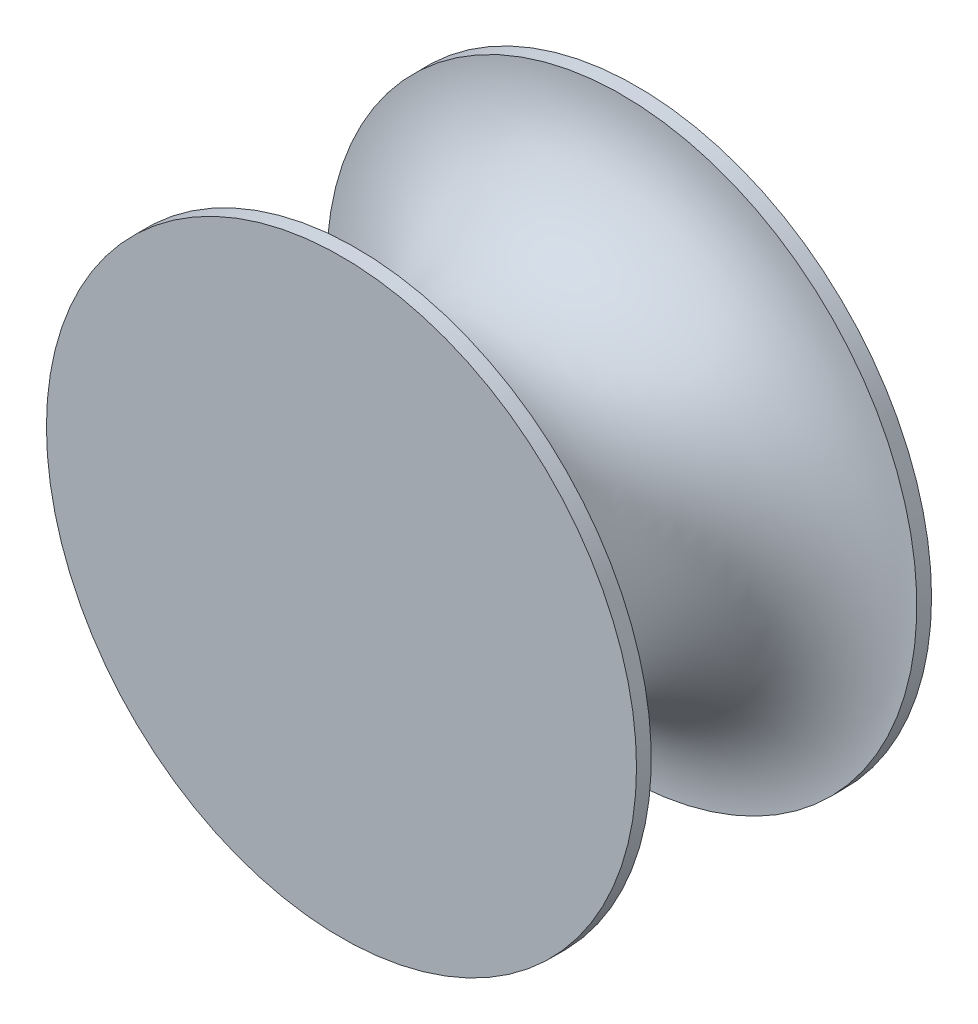
from build123d import *

# Parameters (mm, degrees)
SKETCH1_R           = 12.7
BOSS_EXTRUDE1_DEPTH = 12.7


with BuildPart() as part:
    # Sketch1 → Boss-Extrude1 (new body)
    with BuildSketch(Plane.XY):
        Circle(SKETCH1_R)
    extrude(amount=BOSS_EXTRUDE1_DEPTH)

    # Sketch2 → Cut-Revolve1 (revolve, cut)
    with BuildSketch(Plane(origin=(0, 0, 0), x_dir=(0, 0, -1), z_dir=(1, 0, 0)), mode=Mode.PRIVATE) as cut_revolve1_sk:
        with BuildLine():
            Line((-12.065, 12.7), (-0.635, 12.7))
            ThreePointArc((-0.635, 12.7), (-6.35, 6.985), (-12.065, 12.7))
        make_face()
    revolve(cut_revolve1_sk.sketch.rotate(Axis((0, 0, 6.35), (0, 0, 1)), 90), axis=Axis((0, 0, 6.35), (0, 0, 1)), mode=Mode.SUBTRACT)


solid = part.part
